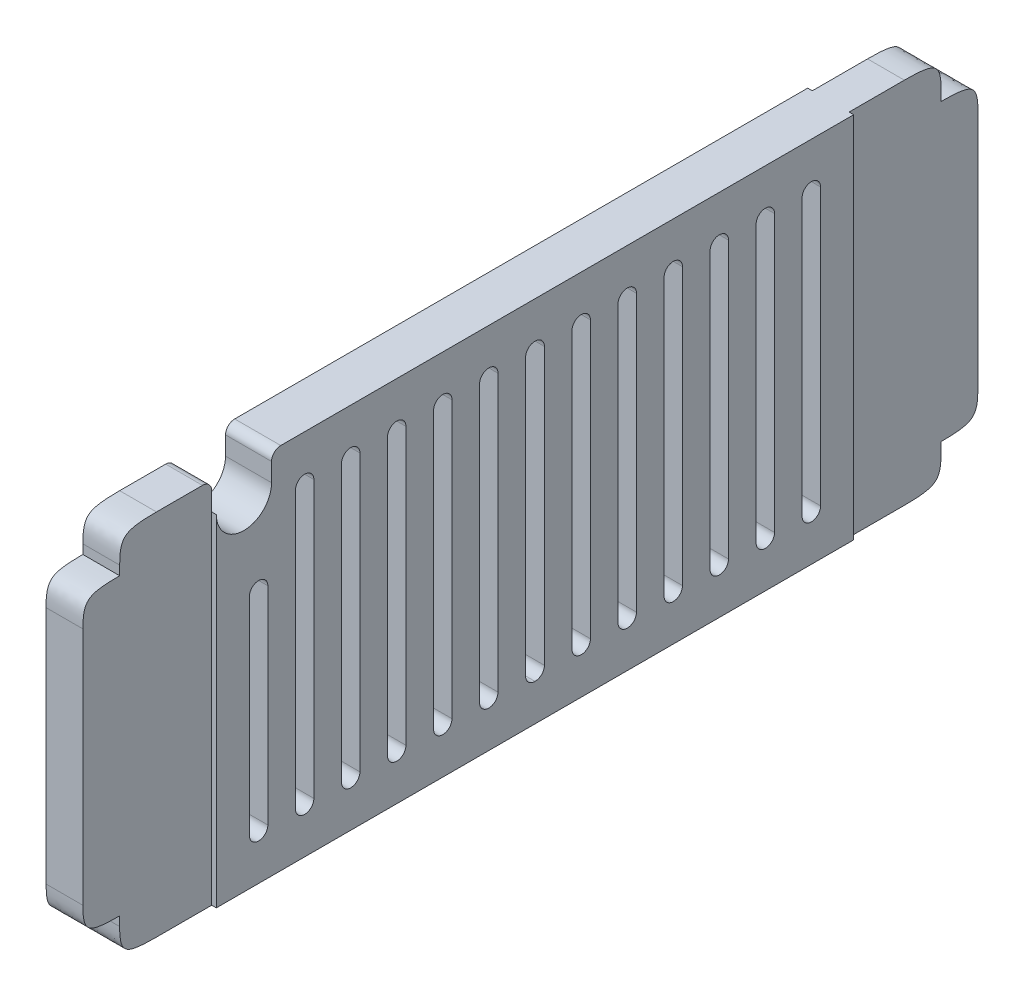
from build123d import *

# Parameters (mm, degrees)
BOSS_EXTRUDE1_DEPTH     = 25.4
SKETCH2_W               = 2.54
SKETCH2_H               = 20.32
BOSS_EXTRUDE2_DEPTH     = 2.54
CUT_EXTRUDE1_DEPTH      = 71.353988153
CUT_EXTRUDE1_DEPTH_BACK = 71.353988153
FILLET1_SIZE            = 2.54
FILLET1_SIZE_2          = 1.905
FILLET2_SIZE            = 2.54
FILLET2_SIZE_2          = 1.905
CUT_EXTRUDE2_DEPTH      = 71.353988282
CUT_EXTRUDE2_DEPTH_BACK = 71.353988282
SKETCH4_W               = 43.097939212
SKETCH4_H               = 25.4
BOSS_EXTRUDE3_START     = -3.175
BOSS_EXTRUDE3_DEPTH     = 3.175
BOSS_EXTRUDE4_DEPTH     = 2.54
CUT_EXTRUDE3_DEPTH      = 59.690250859
BOSS_EXTRUDE5_START     = -3.175
SKETCH10_W              = 50.316222456
SKETCH10_H              = 25.4
BOSS_EXTRUDE5_DEPTH     = 3.175
CUT_EXTRUDE4_DEPTH      = 63.179589879
BOSS_EXTRUDE6_DEPTH     = 2.54
CUT_EXTRUDE5_DEPTH      = 71.362942144
BOSS_EXTRUDE7_DEPTH     = 3.175
BOSS_EXTRUDE8_DEPTH     = 2.54
CUT_EXTRUDE6_DEPTH      = 71.376551108
BOSS_EXTRUDE9_DEPTH     = 3.175
FILLET3_R               = 0.635


with BuildPart() as part:
    # Sketch1 → Boss-Extrude1 (new body)
    with BuildSketch(Plane(origin=(0, 0, 0), x_dir=(1, 0, 0), z_dir=(0, 1, 0))):
        Polygon((0, -6.35), (0, 0), (2.54, 0), (2.54, -6.35), (2.8575, -6.35), (2.8575, -56.642), (2.54, -56.642), (2.54, -62.992), (0, -62.992), (0, -56.642), (-0.3175, -56.642), (-0.3175, -6.35), align=None)
    extrude(amount=BOSS_EXTRUDE1_DEPTH)

    # Sketch2 → Boss-Extrude2 (add)
    with BuildSketch(Plane(origin=(2.54, 0, 0), x_dir=(0, 0, -1), z_dir=(1, 0, 0))):
        with Locations((-64.262, 12.7)):
            Rectangle(SKETCH2_W, SKETCH2_H)
        with Locations((1.27, 12.7)):
            Rectangle(SKETCH2_W, SKETCH2_H)
    extrude(amount=-BOSS_EXTRUDE2_DEPTH)

    # Sketch3 → Cut-Extrude1 (cut, two sides: drawn at the far end of the back side and taken through both)
    with BuildSketch(Plane.ZY.offset(0.3175).offset(-CUT_EXTRUDE1_DEPTH_BACK)):
        with BuildLine():
            Line((30.861, 3.175), (30.861, 22.225))
            ThreePointArc((30.861, 22.225), (31.496, 22.86), (32.131, 22.225))
            Line((32.131, 22.225), (32.131, 3.175))
            ThreePointArc((32.131, 3.175), (31.496, 2.54), (30.861, 3.175))
        make_face()
        with BuildLine():
            Line((35.306, 3.175), (35.306, 22.225))
            ThreePointArc((35.306, 22.225), (34.671, 22.86), (34.036, 22.225))
            Line((34.036, 22.225), (34.036, 3.175))
            ThreePointArc((34.036, 3.175), (34.671, 2.54), (35.306, 3.175))
        make_face()
        with BuildLine():
            Line((38.481, 3.175), (38.481, 22.225))
            ThreePointArc((38.481, 22.225), (37.846, 22.86), (37.211, 22.225))
            Line((37.211, 22.225), (37.211, 3.175))
            ThreePointArc((37.211, 3.175), (37.846, 2.54), (38.481, 3.175))
        make_face()
        with BuildLine():
            Line((41.656, 3.175), (41.656, 22.225))
            ThreePointArc((41.656, 22.225), (41.021, 22.86), (40.386, 22.225))
            Line((40.386, 22.225), (40.386, 3.175))
            ThreePointArc((40.386, 3.175), (41.021, 2.54), (41.656, 3.175))
        make_face()
        with BuildLine():
            Line((44.831, 3.175), (44.831, 22.225))
            ThreePointArc((44.831, 22.225), (44.196, 22.86), (43.561, 22.225))
            Line((43.561, 22.225), (43.561, 3.175))
            ThreePointArc((43.561, 3.175), (44.196, 2.54), (44.831, 3.175))
        make_face()
        with BuildLine():
            Line((48.006, 3.175), (48.006, 22.225))
            ThreePointArc((48.006, 22.225), (47.371, 22.86), (46.736, 22.225))
            Line((46.736, 22.225), (46.736, 3.175))
            ThreePointArc((46.736, 3.175), (47.371, 2.54), (48.006, 3.175))
        make_face()
        with BuildLine():
            Line((51.181, 3.175), (51.181, 22.225))
            ThreePointArc((51.181, 22.225), (50.546, 22.86), (49.911, 22.225))
            Line((49.911, 22.225), (49.911, 3.175))
            ThreePointArc((49.911, 3.175), (50.546, 2.54), (51.181, 3.175))
        make_face()
        with BuildLine():
            Line((54.356, 3.175), (54.356, 22.225))
            ThreePointArc((54.356, 22.225), (53.721, 22.86), (53.086, 22.225))
            Line((53.086, 22.225), (53.086, 3.175))
            ThreePointArc((53.086, 3.175), (53.721, 2.54), (54.356, 3.175))
        make_face()
        with BuildLine():
            Line((27.686, 3.175), (27.686, 22.225))
            ThreePointArc((27.686, 22.225), (28.321, 22.86), (28.956, 22.225))
            Line((28.956, 22.225), (28.956, 3.175))
            ThreePointArc((28.956, 3.175), (28.321, 2.54), (27.686, 3.175))
        make_face()
        with BuildLine():
            Line((24.511, 3.175), (24.511, 22.225))
            ThreePointArc((24.511, 22.225), (25.146, 22.86), (25.781, 22.225))
            Line((25.781, 22.225), (25.781, 3.175))
            ThreePointArc((25.781, 3.175), (25.146, 2.54), (24.511, 3.175))
        make_face()
        with BuildLine():
            Line((21.336, 3.175), (21.336, 22.225))
            ThreePointArc((21.336, 22.225), (21.971, 22.86), (22.606, 22.225))
            Line((22.606, 22.225), (22.606, 3.175))
            ThreePointArc((22.606, 3.175), (21.971, 2.54), (21.336, 3.175))
        make_face()
        with BuildLine():
            Line((18.161, 3.175), (18.161, 22.225))
            ThreePointArc((18.161, 22.225), (18.796, 22.86), (19.431, 22.225))
            Line((19.431, 22.225), (19.431, 3.175))
            ThreePointArc((19.431, 3.175), (18.796, 2.54), (18.161, 3.175))
        make_face()
        with BuildLine():
            Line((14.986, 3.175), (14.986, 22.225))
            ThreePointArc((14.986, 22.225), (15.621, 22.86), (16.256, 22.225))
            Line((16.256, 22.225), (16.256, 3.175))
            ThreePointArc((16.256, 3.175), (15.621, 2.54), (14.986, 3.175))
        make_face()
        with BuildLine():
            Line((11.811, 3.175), (11.811, 22.225))
            ThreePointArc((11.811, 22.225), (12.446, 22.86), (13.081, 22.225))
            Line((13.081, 22.225), (13.081, 3.175))
            ThreePointArc((13.081, 3.175), (12.446, 2.54), (11.811, 3.175))
        make_face()
        with BuildLine():
            Line((8.636, 3.175), (8.636, 22.225))
            ThreePointArc((8.636, 22.225), (9.271, 22.86), (9.906, 22.225))
            Line((9.906, 22.225), (9.906, 3.175))
            ThreePointArc((9.906, 3.175), (9.271, 2.54), (8.636, 3.175))
        make_face()
    extrude(amount=CUT_EXTRUDE1_DEPTH + CUT_EXTRUDE1_DEPTH_BACK, mode=Mode.SUBTRACT)

    # Fillet1
    # a fillet whose section is not a circle: 2.54, 1.905 mm, written as the material it takes off along each edge
    with BuildSketch(Plane(origin=(8.89, 22.86, 65.532), x_dir=(0, 0, -1), z_dir=(-1, 0, 0)), Plane(origin=(8.89, 25.4, 62.992), x_dir=(0, 0, -1), z_dir=(-1, 0, 0))) as fillet1_piece_1:
        with BuildLine():
            Bezier((FILLET1_SIZE, 0), (0, 0), (0, FILLET1_SIZE_2), weights=[1, 1.857142857, 1])
            Line((0, FILLET1_SIZE_2), (0, 0))
            Line((0, 0), (FILLET1_SIZE, 0))
        make_face()
    extrude(amount=15.24, mode=Mode.SUBTRACT)
    with BuildSketch(Plane(origin=(8.89, 2.54, -2.54), x_dir=(0, 1, 0), z_dir=(-1, 0, 0))) as fillet1_piece_2:
        with BuildLine():
            Bezier((FILLET1_SIZE_2, 0), (0, 0), (0, -FILLET1_SIZE), weights=[1, 1.857142857, 1])
            Line((0, -FILLET1_SIZE), (0, 0))
            Line((0, 0), (FILLET1_SIZE_2, 0))
        make_face()
    extrude(amount=15.24, mode=Mode.SUBTRACT)
    with BuildSketch(Plane(origin=(-6.35, 0, 0), x_dir=(0, 1, 0), z_dir=(1, 0, 0))) as fillet1_piece_3:
        with BuildLine():
            Bezier((FILLET1_SIZE_2, 0), (0, 0), (0, FILLET1_SIZE), weights=[1, 1.857142857, 1])
            Line((0, FILLET1_SIZE), (0, 0))
            Line((0, 0), (FILLET1_SIZE_2, 0))
        make_face()
    extrude(amount=15.24, mode=Mode.SUBTRACT)

    # Fillet2
    # a fillet whose section is not a circle: 2.54, 1.905 mm, written as the material it takes off along each edge
    with BuildSketch(Plane(origin=(8.89, 0, 62.992), x_dir=(0, 0, -1), z_dir=(-1, 0, 0))) as fillet2_piece_1:
        with BuildLine():
            Bezier((FILLET2_SIZE, 0), (0, 0), (0, -FILLET2_SIZE_2), weights=[1, 1.857142857, 1])
            Line((0, -FILLET2_SIZE_2), (0, 0))
            Line((0, 0), (FILLET2_SIZE, 0))
        make_face()
    extrude(amount=15.24, mode=Mode.SUBTRACT)
    with BuildSketch(Plane(origin=(8.89, 2.54, 65.532), x_dir=(0, 1, 0), z_dir=(-1, 0, 0)), Plane(origin=(8.89, 22.86, -2.54), x_dir=(0, -1, 0), z_dir=(-1, 0, 0))) as fillet2_piece_2:
        with BuildLine():
            Bezier((FILLET2_SIZE_2, 0), (0, 0), (0, FILLET2_SIZE), weights=[1, 1.857142857, 1])
            Line((0, FILLET2_SIZE), (0, 0))
            Line((0, 0), (FILLET2_SIZE_2, 0))
        make_face()
    extrude(amount=15.24, mode=Mode.SUBTRACT)
    with BuildSketch(Plane(origin=(-6.35, 25.4, 0), x_dir=(0, -1, 0), z_dir=(1, 0, 0))) as fillet2_piece_3:
        with BuildLine():
            Bezier((FILLET2_SIZE_2, 0), (0, 0), (0, -FILLET2_SIZE), weights=[1, 1.857142857, 1])
            Line((0, -FILLET2_SIZE), (0, 0))
            Line((0, 0), (FILLET2_SIZE_2, 0))
        make_face()
    extrude(amount=15.24, mode=Mode.SUBTRACT)

    # Sketch4 → Cut-Extrude2 (cut, two sides: drawn at the far end of the back side and taken through both)
    with BuildSketch(Plane.ZY.offset(0.3175).offset(-CUT_EXTRUDE2_DEPTH_BACK)):
        with Locations((46.694969606, 12.7)):
            Rectangle(SKETCH4_W, SKETCH4_H)
    extrude(amount=CUT_EXTRUDE2_DEPTH + CUT_EXTRUDE2_DEPTH_BACK, mode=Mode.SUBTRACT)

    # Sketch5 → Boss-Extrude3 (add)
    with BuildSketch(Plane.ZY.offset(0.3175).offset(BOSS_EXTRUDE3_START)):
        with BuildLine():
            Line((25.146, 2.54), (25.146, 0))
            Line((25.146, 0), (43.942, 0))
            Line((43.942, 0), (43.942, 25.4))
            Line((43.942, 25.4), (25.146, 25.4))
            Line((25.146, 25.4), (25.146, 22.86))
            ThreePointArc((25.146, 22.86), (25.595012806, 22.674012806), (25.781, 22.225))
            Line((25.781, 22.225), (25.781, 3.175))
            ThreePointArc((25.781, 3.175), (25.595012806, 2.725987194), (25.146, 2.54))
        make_face()
        with BuildLine():
            ThreePointArc((28.956, 3.175), (28.321, 2.54), (27.686, 3.175))
            Line((27.686, 3.175), (27.686, 22.225))
            ThreePointArc((27.686, 22.225), (28.321, 22.86), (28.956, 22.225))
            Line((28.956, 22.225), (28.956, 3.175))
        make_face(mode=Mode.SUBTRACT)
        with BuildLine():
            ThreePointArc((32.131, 3.175), (31.496, 2.54), (30.861, 3.175))
            Line((30.861, 3.175), (30.861, 22.225))
            ThreePointArc((30.861, 22.225), (31.496, 22.86), (32.131, 22.225))
            Line((32.131, 22.225), (32.131, 3.175))
        make_face(mode=Mode.SUBTRACT)
        with BuildLine():
            ThreePointArc((35.306, 3.175), (34.671, 2.54), (34.036, 3.175))
            Line((34.036, 3.175), (34.036, 22.225))
            ThreePointArc((34.036, 22.225), (34.671, 22.86), (35.306, 22.225))
            Line((35.306, 22.225), (35.306, 3.175))
        make_face(mode=Mode.SUBTRACT)
        with BuildLine():
            ThreePointArc((38.481, 3.175), (37.846, 2.54), (37.211, 3.175))
            Line((37.211, 3.175), (37.211, 22.225))
            ThreePointArc((37.211, 22.225), (37.846, 22.86), (38.481, 22.225))
            Line((38.481, 22.225), (38.481, 3.175))
        make_face(mode=Mode.SUBTRACT)
        with BuildLine():
            ThreePointArc((41.656, 3.175), (41.021, 2.54), (40.386, 3.175))
            Line((40.386, 3.175), (40.386, 22.225))
            ThreePointArc((40.386, 22.225), (41.021, 22.86), (41.656, 22.225))
            Line((41.656, 22.225), (41.656, 3.175))
        make_face(mode=Mode.SUBTRACT)
    extrude(amount=BOSS_EXTRUDE3_DEPTH)

    # Sketch7 → Boss-Extrude4 (add)
    with BuildSketch(Plane(origin=(2.54, 0, 0), x_dir=(0, 0, -1), z_dir=(1, 0, 0))):
        with BuildLine():
            Line((-52.832, 4.445), (-52.832, 20.955))
            add(Edge.make_bspline(
                [(-52.832, 20.955), (-52.832, 21.566264843), (-52.750077784, 21.912584205), (-52.686519964, 22.181269612), (-52.560992149, 22.351895719), (-52.424583279, 22.537312112), (-52.184197152, 22.64402579), (-51.86738437, 22.784667255), (-51.247913024, 22.831116446), (-50.862706444, 22.86), (-50.292, 22.86)],
                knots=[0, 0, 0, 0.25, 0.25, 0.375, 0.375, 0.5, 0.5, 0.75, 0.75, 1, 1, 1], degree=2))
            Line((-50.292, 22.86), (-50.292, 23.495))
            add(Edge.make_bspline(
                [(-50.292, 23.495), (-50.292, 24.106264843), (-50.210077784, 24.452584205), (-50.146519964, 24.721269612), (-50.020992149, 24.891895719), (-49.884583279, 25.077312112), (-49.644197152, 25.18402579), (-49.32738437, 25.324667255), (-48.707913024, 25.371116446), (-48.322706444, 25.4), (-47.752, 25.4)],
                knots=[0, 0, 0, 0.25, 0.25, 0.375, 0.375, 0.5, 0.5, 0.75, 0.75, 1, 1, 1], degree=2))
            Line((-47.752, 25.4), (-43.942, 25.4))
            Line((-43.942, 25.4), (-43.942, 0))
            Line((-43.942, 0), (-47.752, 0))
            add(Edge.make_bspline(
                [(-47.752, 0), (-48.318489299, 0), (-48.702995081, 0.028516811), (-48.970475744, 0.048354472), (-49.174540832, 0.083620934), (-49.44980427, 0.13119187), (-49.637333595, 0.212954611), (-49.87968847, 0.318621278), (-50.018240947, 0.504390158), (-50.145388249, 0.674867167), (-50.209974667, 0.946980609), (-50.292, 1.29256713), (-50.292, 1.905)],
                knots=[0, 0, 0, 0.25, 0.25, 0.375, 0.375, 0.5, 0.5, 0.625, 0.625, 0.75, 0.75, 1, 1, 1], degree=2))
            Line((-50.292, 1.905), (-50.292, 2.54))
            add(Edge.make_bspline(
                [(-50.292, 2.54), (-50.858489299, 2.54), (-51.242995081, 2.568516811), (-51.510475744, 2.588354472), (-51.714540832, 2.623620934), (-51.98980427, 2.67119187), (-52.177333595, 2.752954611), (-52.41968847, 2.858621278), (-52.558240947, 3.044390158), (-52.685388249, 3.214867167), (-52.749974667, 3.486980609), (-52.832, 3.83256713), (-52.832, 4.445)],
                knots=[0, 0, 0, 0.25, 0.25, 0.375, 0.375, 0.5, 0.5, 0.625, 0.625, 0.75, 0.75, 1, 1, 1], degree=2))
        make_face()
        with BuildLine():
            Line((0, 22.86), (0, 23.495))
            add(Edge.make_bspline(
                [(0, 23.495), (0, 24.106264843), (-0.081922216, 24.452584205), (-0.145480036, 24.721269612), (-0.271007851, 24.891895719), (-0.407416721, 25.077312112), (-0.647802848, 25.18402579), (-0.96461563, 25.324667255), (-1.584086976, 25.371116446), (-1.969293556, 25.4), (-2.54, 25.4)],
                knots=[0, 0, 0, 0.25, 0.25, 0.375, 0.375, 0.5, 0.5, 0.75, 0.75, 1, 1, 1], degree=2))
            Line((-2.54, 25.4), (-6.35, 25.4))
            Line((-6.35, 25.4), (-6.35, 0))
            Line((-6.35, 0), (-2.54, 0))
            add(Edge.make_bspline(
                [(-2.54, 0), (-1.973510701, 0), (-1.589004919, 0.028516811), (-1.321524256, 0.048354472), (-1.117459168, 0.083620934), (-0.84219573, 0.13119187), (-0.654666405, 0.212954611), (-0.41231153, 0.318621278), (-0.273759053, 0.504390158), (-0.146611751, 0.674867167), (-0.082025333, 0.946980609), (0, 1.29256713), (0, 1.905)],
                knots=[0, 0, 0, 0.25, 0.25, 0.375, 0.375, 0.5, 0.5, 0.625, 0.625, 0.75, 0.75, 1, 1, 1], degree=2))
            Line((0, 1.905), (0, 2.54))
            add(Edge.make_bspline(
                [(0, 2.54), (0.566489299, 2.54), (0.950995081, 2.568516811), (1.218475744, 2.588354472), (1.422540832, 2.623620934), (1.69780427, 2.67119187), (1.885333595, 2.752954611), (2.12768847, 2.858621278), (2.266240947, 3.044390158), (2.393388249, 3.214867167), (2.457974667, 3.486980609), (2.54, 3.83256713), (2.54, 4.445)],
                knots=[0, 0, 0, 0.25, 0.25, 0.375, 0.375, 0.5, 0.5, 0.625, 0.625, 0.75, 0.75, 1, 1, 1], degree=2))
            Line((2.54, 4.445), (2.54, 20.955))
            add(Edge.make_bspline(
                [(2.54, 20.955), (2.54, 21.566264843), (2.458077784, 21.912584205), (2.394519964, 22.181269612), (2.268992149, 22.351895719), (2.132583279, 22.537312112), (1.892197152, 22.64402579), (1.57538437, 22.784667255), (0.955913024, 22.831116446), (0.570706444, 22.86), (0, 22.86)],
                knots=[0, 0, 0, 0.25, 0.25, 0.375, 0.375, 0.5, 0.5, 0.75, 0.75, 1, 1, 1], degree=2))
        make_face()
    extrude(amount=-BOSS_EXTRUDE4_DEPTH)

    # Sketch9 → Cut-Extrude3 (cut, through all)
    with BuildSketch(Plane(origin=(0, 25.4, 0), x_dir=(1, 0, 0), z_dir=(0, 1, 0))):
        Polygon((2.54, -31.508111228), (13.884104401, -31.508111228), (13.884104401, -57.156449868), (-12.424079093, -57.156449868), (-12.424079093, -31.508111228), align=None)
    extrude(amount=-CUT_EXTRUDE3_DEPTH, mode=Mode.SUBTRACT)

    # Sketch10 → Boss-Extrude5 (add)
    with BuildSketch(Plane.ZY.offset(0.3175).offset(BOSS_EXTRUDE5_START)):
        with Locations((31.508111228, 12.7)):
            Rectangle(SKETCH10_W, SKETCH10_H)
        with BuildLine():
            Line((27.686, 3.175), (27.686, 22.225))
            ThreePointArc((27.686, 22.225), (28.321, 22.86), (28.956, 22.225))
            Line((28.956, 22.225), (28.956, 3.175))
            ThreePointArc((28.956, 3.175), (28.321, 2.54), (27.686, 3.175))
        make_face(mode=Mode.SUBTRACT)
        with BuildLine():
            Line((24.511, 3.175), (24.511, 22.225))
            ThreePointArc((24.511, 22.225), (25.146, 22.86), (25.781, 22.225))
            Line((25.781, 22.225), (25.781, 3.175))
            ThreePointArc((25.781, 3.175), (25.146, 2.54), (24.511, 3.175))
        make_face(mode=Mode.SUBTRACT)
        with BuildLine():
            Line((21.336, 3.175), (21.336, 22.225))
            ThreePointArc((21.336, 22.225), (21.971, 22.86), (22.606, 22.225))
            Line((22.606, 22.225), (22.606, 3.175))
            ThreePointArc((22.606, 3.175), (21.971, 2.54), (21.336, 3.175))
        make_face(mode=Mode.SUBTRACT)
        with BuildLine():
            Line((18.161, 3.175), (18.161, 22.225))
            ThreePointArc((18.161, 22.225), (18.796, 22.86), (19.431, 22.225))
            Line((19.431, 22.225), (19.431, 3.175))
            ThreePointArc((19.431, 3.175), (18.796, 2.54), (18.161, 3.175))
        make_face(mode=Mode.SUBTRACT)
        with BuildLine():
            Line((14.986, 3.175), (14.986, 22.225))
            ThreePointArc((14.986, 22.225), (15.621, 22.86), (16.256, 22.225))
            Line((16.256, 22.225), (16.256, 3.175))
            ThreePointArc((16.256, 3.175), (15.621, 2.54), (14.986, 3.175))
        make_face(mode=Mode.SUBTRACT)
        with BuildLine():
            Line((11.811, 3.175), (11.811, 22.225))
            ThreePointArc((11.811, 22.225), (12.446, 22.86), (13.081, 22.225))
            Line((13.081, 22.225), (13.081, 3.175))
            ThreePointArc((13.081, 3.175), (12.446, 2.54), (11.811, 3.175))
        make_face(mode=Mode.SUBTRACT)
        with BuildLine():
            Line((8.636, 3.175), (8.636, 22.225))
            ThreePointArc((8.636, 22.225), (9.271, 22.86), (9.906, 22.225))
            Line((9.906, 22.225), (9.906, 3.175))
            ThreePointArc((9.906, 3.175), (9.271, 2.54), (8.636, 3.175))
        make_face(mode=Mode.SUBTRACT)
        with BuildLine():
            Line((53.110222456, 22.225), (53.110222456, 3.175))
            ThreePointArc((53.110222456, 3.175), (53.745222456, 2.54), (54.380222456, 3.175))
            Line((54.380222456, 3.175), (54.380222456, 22.225))
            ThreePointArc((54.380222456, 22.225), (53.745222456, 22.86), (53.110222456, 22.225))
        make_face(mode=Mode.SUBTRACT)
        with BuildLine():
            Line((49.935222456, 22.225), (49.935222456, 3.175))
            ThreePointArc((49.935222456, 3.175), (50.570222456, 2.54), (51.205222456, 3.175))
            Line((51.205222456, 3.175), (51.205222456, 22.225))
            ThreePointArc((51.205222456, 22.225), (50.570222456, 22.86), (49.935222456, 22.225))
        make_face(mode=Mode.SUBTRACT)
        with BuildLine():
            Line((46.760222456, 22.225), (46.760222456, 3.175))
            ThreePointArc((46.760222456, 3.175), (47.395222456, 2.54), (48.030222456, 3.175))
            Line((48.030222456, 3.175), (48.030222456, 22.225))
            ThreePointArc((48.030222456, 22.225), (47.395222456, 22.86), (46.760222456, 22.225))
        make_face(mode=Mode.SUBTRACT)
        with BuildLine():
            Line((43.585222456, 22.225), (43.585222456, 3.175))
            ThreePointArc((43.585222456, 3.175), (44.220222456, 2.54), (44.855222456, 3.175))
            Line((44.855222456, 3.175), (44.855222456, 22.225))
            ThreePointArc((44.855222456, 22.225), (44.220222456, 22.86), (43.585222456, 22.225))
        make_face(mode=Mode.SUBTRACT)
        with BuildLine():
            Line((40.410222456, 22.225), (40.410222456, 3.175))
            ThreePointArc((40.410222456, 3.175), (41.045222456, 2.54), (41.680222456, 3.175))
            Line((41.680222456, 3.175), (41.680222456, 22.225))
            ThreePointArc((41.680222456, 22.225), (41.045222456, 22.86), (40.410222456, 22.225))
        make_face(mode=Mode.SUBTRACT)
        with BuildLine():
            Line((37.235222456, 22.225), (37.235222456, 3.175))
            ThreePointArc((37.235222456, 3.175), (37.870222456, 2.54), (38.505222456, 3.175))
            Line((38.505222456, 3.175), (38.505222456, 22.225))
            ThreePointArc((38.505222456, 22.225), (37.870222456, 22.86), (37.235222456, 22.225))
        make_face(mode=Mode.SUBTRACT)
        with BuildLine():
            Line((34.060222456, 22.225), (34.060222456, 3.175))
            ThreePointArc((34.060222456, 3.175), (34.695222456, 2.54), (35.330222456, 3.175))
            Line((35.330222456, 3.175), (35.330222456, 22.225))
            ThreePointArc((35.330222456, 22.225), (34.695222456, 22.86), (34.060222456, 22.225))
        make_face(mode=Mode.SUBTRACT)
    extrude(amount=BOSS_EXTRUDE5_DEPTH)

    # Sketch11 → Cut-Extrude4 (cut, through all)
    with BuildSketch(Plane.ZY.offset(0.3175)):
        with BuildLine():
            Line((27.686, 3.175), (27.686, 22.225))
            ThreePointArc((27.686, 22.225), (28.321, 22.86), (28.956, 22.225))
            Line((28.956, 22.225), (28.956, 3.175))
            ThreePointArc((28.956, 3.175), (28.321, 2.54), (27.686, 3.175))
        make_face()
        with BuildLine():
            Line((32.131, 22.225), (32.131, 3.175))
            ThreePointArc((32.131, 3.175), (31.496, 2.54), (30.861, 3.175))
            Line((30.861, 3.175), (30.861, 22.225))
            ThreePointArc((30.861, 22.225), (31.496, 22.86), (32.131, 22.225))
        make_face()
    extrude(amount=-CUT_EXTRUDE4_DEPTH, mode=Mode.SUBTRACT)

    # Sketch12 → Boss-Extrude6 (add)
    with BuildSketch(Plane.ZY):
        with BuildLine():
            Line((56.666222456, 0), (56.666222456, 25.4))
            Line((56.666222456, 25.4), (60.476222456, 25.4))
            add(Edge.make_bspline(
                [(60.476222456, 25.4), (61.042706071, 25.4), (61.427217537, 25.371483189), (62.043328615, 25.325790083), (62.361556051, 25.187045389), (62.603904826, 25.081383202), (62.742463403, 24.895609842), (62.869607737, 24.725140205), (62.934197123, 24.453019391), (63.016222456, 24.107439388), (63.016222456, 23.495)],
                knots=[0, 0, 0, 0.25, 0.25, 0.5, 0.5, 0.625, 0.625, 0.75, 0.75, 1, 1, 1], degree=2))
            Line((63.016222456, 23.495), (63.016222456, 22.86))
            add(Edge.make_bspline(
                [(63.016222456, 22.86), (63.582706071, 22.86), (63.967217537, 22.831483189), (64.583328615, 22.785790083), (64.901556051, 22.647045389), (65.143904826, 22.541383202), (65.282463403, 22.355609842), (65.409607737, 22.185140205), (65.474197123, 21.913019391), (65.556222456, 21.567439388), (65.556222456, 20.955)],
                knots=[0, 0, 0, 0.25, 0.25, 0.5, 0.5, 0.625, 0.625, 0.75, 0.75, 1, 1, 1], degree=2))
            Line((65.556222456, 20.955), (65.556222456, 4.445))
            add(Edge.make_bspline(
                [(65.556222456, 4.445), (65.556222456, 3.833768563), (65.47430024, 3.487415795), (65.410750299, 3.218737782), (65.285214605, 3.048104281), (65.148812167, 2.862700233), (64.908419608, 2.75597421), (64.72271898, 2.673529523), (64.447164672, 2.625085298), (64.243032164, 2.589197487), (63.97213548, 2.568883554), (63.586958517, 2.54), (63.016222456, 2.54)],
                knots=[0, 0, 0, 0.25, 0.25, 0.375, 0.375, 0.5, 0.5, 0.625, 0.625, 0.75, 0.75, 1, 1, 1], degree=2))
            Line((63.016222456, 2.54), (63.016222456, 1.905))
            add(Edge.make_bspline(
                [(63.016222456, 1.905), (63.016222456, 1.293768563), (62.93430024, 0.947415795), (62.870750299, 0.678737782), (62.745214605, 0.508104281), (62.608812167, 0.322700233), (62.368419608, 0.21597421), (62.18271898, 0.133529523), (61.907164672, 0.085085298), (61.703032164, 0.049197487), (61.43213548, 0.028883554), (61.046958516, 0), (60.476222456, 0)],
                knots=[0, 0, 0, 0.25, 0.25, 0.375, 0.375, 0.5, 0.5, 0.625, 0.625, 0.75, 0.75, 1, 1, 1], degree=2))
            Line((60.476222456, 0), (56.666222456, 0))
        make_face()
        with BuildLine():
            Line((6.35, 25.4), (2.54, 25.4))
            add(Edge.make_bspline(
                [(2.54, 25.4), (1.973516385, 25.4), (1.589004919, 25.371483189), (0.972893841, 25.325790083), (0.654666405, 25.187045389), (0.41231763, 25.081383202), (0.273759053, 24.895609842), (0.146614719, 24.725140205), (0.082025333, 24.453019391), (0, 24.107439388), (0, 23.495)],
                knots=[0, 0, 0, 0.25, 0.25, 0.5, 0.5, 0.625, 0.625, 0.75, 0.75, 1, 1, 1], degree=2))
            Line((0, 23.495), (0, 22.86))
            add(Edge.make_bspline(
                [(0, 22.86), (-0.566483615, 22.86), (-0.950995081, 22.831483189), (-1.567106159, 22.785790083), (-1.885333595, 22.647045389), (-2.12768237, 22.541383202), (-2.266240947, 22.355609842), (-2.393385281, 22.185140205), (-2.457974667, 21.913019391), (-2.54, 21.567439388), (-2.54, 20.955)],
                knots=[0, 0, 0, 0.25, 0.25, 0.5, 0.5, 0.625, 0.625, 0.75, 0.75, 1, 1, 1], degree=2))
            Line((-2.54, 20.955), (-2.54, 4.445))
            add(Edge.make_bspline(
                [(-2.54, 4.445), (-2.54, 3.833768563), (-2.458077784, 3.487415795), (-2.394527843, 3.218737782), (-2.268992149, 3.048104281), (-2.132589711, 2.862700233), (-1.892197152, 2.75597421), (-1.706496524, 2.673529523), (-1.430942216, 2.625085298), (-1.226809708, 2.589197487), (-0.955913024, 2.568883554), (-0.570736061, 2.54), (0, 2.54)],
                knots=[0, 0, 0, 0.25, 0.25, 0.375, 0.375, 0.5, 0.5, 0.625, 0.625, 0.75, 0.75, 1, 1, 1], degree=2))
            Line((0, 2.54), (0, 1.905))
            add(Edge.make_bspline(
                [(0, 1.905), (0, 1.293768563), (0.081922216, 0.947415795), (0.145472157, 0.678737782), (0.271007851, 0.508104281), (0.407410289, 0.322700233), (0.647802848, 0.21597421), (0.833503476, 0.133529523), (1.109057784, 0.085085298), (1.313190292, 0.049197487), (1.584086976, 0.028883554), (1.96926394, 0), (2.54, 0)],
                knots=[0, 0, 0, 0.25, 0.25, 0.375, 0.375, 0.5, 0.5, 0.625, 0.625, 0.75, 0.75, 1, 1, 1], degree=2))
            Line((2.54, 0), (6.35, 0))
            Line((6.35, 0), (6.35, 25.4))
        make_face()
    extrude(amount=-BOSS_EXTRUDE6_DEPTH)

    # Sketch14 → Cut-Extrude5 (cut, through all)
    with BuildSketch(Plane(origin=(0, 25.4, 0), x_dir=(1, 0, 0), z_dir=(0, 1, 0))):
        Polygon((-0.3175, -34.682375136), (17.206407461, -34.682375136), (17.206407461, 7.164237544), (-50.816625814, 7.164237544), align=None)
    extrude(amount=-CUT_EXTRUDE5_DEPTH, mode=Mode.SUBTRACT)

    # Sketch15 → Boss-Extrude7 (add)
    with BuildSketch(Plane.ZY.offset(0.3175)):
        with BuildLine():
            Line((34.682375136, 22.859870023), (34.682375136, 25.4))
            Line((34.682375136, 25.4), (12.698527816, 25.4))
            Line((12.698527816, 25.4), (12.698527816, 0))
            Line((12.698527816, 0), (34.682375136, 0))
            Line((34.682375136, 0), (34.682375136, 2.540129977))
            ThreePointArc((34.682375136, 2.540129977), (34.225080433, 2.721467725), (34.034527816, 3.175))
            Line((34.034527816, 3.175), (34.034527816, 22.225))
            ThreePointArc((34.034527816, 22.225), (34.225080433, 22.678532275), (34.682375136, 22.859870023))
        make_face()
        with BuildLine():
            ThreePointArc((16.254527816, 3.175), (15.619527816, 2.54), (14.984527816, 3.175))
            Line((14.984527816, 3.175), (14.984527816, 22.225))
            ThreePointArc((14.984527816, 22.225), (15.619527816, 22.86), (16.254527816, 22.225))
            Line((16.254527816, 22.225), (16.254527816, 3.175))
        make_face(mode=Mode.SUBTRACT)
        with BuildLine():
            ThreePointArc((19.429527816, 3.175), (18.794527816, 2.54), (18.159527816, 3.175))
            Line((18.159527816, 3.175), (18.159527816, 22.225))
            ThreePointArc((18.159527816, 22.225), (18.794527816, 22.86), (19.429527816, 22.225))
            Line((19.429527816, 22.225), (19.429527816, 3.175))
        make_face(mode=Mode.SUBTRACT)
        with BuildLine():
            ThreePointArc((22.604527816, 3.175), (21.969527816, 2.54), (21.334527816, 3.175))
            Line((21.334527816, 3.175), (21.334527816, 22.225))
            ThreePointArc((21.334527816, 22.225), (21.969527816, 22.86), (22.604527816, 22.225))
            Line((22.604527816, 22.225), (22.604527816, 3.175))
        make_face(mode=Mode.SUBTRACT)
        with BuildLine():
            ThreePointArc((25.779527816, 3.175), (25.144527816, 2.54), (24.509527816, 3.175))
            Line((24.509527816, 3.175), (24.509527816, 22.225))
            ThreePointArc((24.509527816, 22.225), (25.144527816, 22.86), (25.779527816, 22.225))
            Line((25.779527816, 22.225), (25.779527816, 3.175))
        make_face(mode=Mode.SUBTRACT)
        with BuildLine():
            ThreePointArc((28.954527816, 3.175), (28.319527816, 2.54), (27.684527816, 3.175))
            Line((27.684527816, 3.175), (27.684527816, 22.225))
            ThreePointArc((27.684527816, 22.225), (28.319527816, 22.86), (28.954527816, 22.225))
            Line((28.954527816, 22.225), (28.954527816, 3.175))
        make_face(mode=Mode.SUBTRACT)
        with BuildLine():
            ThreePointArc((30.859527816, 22.225), (31.494527816, 22.86), (32.129527816, 22.225))
            Line((32.129527816, 22.225), (32.129527816, 3.175))
            ThreePointArc((32.129527816, 3.175), (31.494527816, 2.54), (30.859527816, 3.175))
            Line((30.859527816, 3.175), (30.859527816, 22.225))
        make_face(mode=Mode.SUBTRACT)
    extrude(amount=-BOSS_EXTRUDE7_DEPTH)

    # Sketch16 → Boss-Extrude8 (add)
    with BuildSketch(Plane(origin=(2.54, 0, 0), x_dir=(0, 0, -1), z_dir=(1, 0, 0))):
        with BuildLine():
            Line((-12.698527816, 0), (-12.698527816, 25.4))
            Line((-12.698527816, 25.4), (-8.888527816, 25.4))
            add(Edge.make_bspline(
                [(-8.888527816, 25.4), (-8.322044201, 25.4), (-7.937532735, 25.371483189), (-7.321421657, 25.325790083), (-7.003194221, 25.187045389), (-6.760845446, 25.081383202), (-6.622286869, 24.895609842), (-6.495142535, 24.725140205), (-6.430553149, 24.453019391), (-6.348527816, 24.107439388), (-6.348527816, 23.495)],
                knots=[0, 0, 0, 0.25, 0.25, 0.5, 0.5, 0.625, 0.625, 0.75, 0.75, 1, 1, 1], degree=2))
            Line((-6.348527816, 23.495), (-6.348527816, 22.86))
            add(Edge.make_bspline(
                [(-6.348527816, 22.86), (-5.782044201, 22.86), (-5.397532735, 22.831483189), (-4.781421657, 22.785790083), (-4.463194221, 22.647045389), (-4.220845446, 22.541383202), (-4.082286869, 22.355609842), (-3.955142535, 22.185140205), (-3.890553149, 21.913019391), (-3.808527816, 21.567439388), (-3.808527816, 20.955)],
                knots=[0, 0, 0, 0.25, 0.25, 0.5, 0.5, 0.625, 0.625, 0.75, 0.75, 1, 1, 1], degree=2))
            Line((-3.808527816, 20.955), (-3.808527816, 4.445))
            add(Edge.make_bspline(
                [(-3.808527816, 4.445), (-3.808527816, 3.833768563), (-3.890450032, 3.487415795), (-3.953999973, 3.218737782), (-4.079535667, 3.048104281), (-4.215938105, 2.862700233), (-4.456330664, 2.75597421), (-4.642031292, 2.673529523), (-4.9175856, 2.625085298), (-5.121718108, 2.589197487), (-5.392614792, 2.568883554), (-5.777791755, 2.54), (-6.348527816, 2.54)],
                knots=[0, 0, 0, 0.25, 0.25, 0.375, 0.375, 0.5, 0.5, 0.625, 0.625, 0.75, 0.75, 1, 1, 1], degree=2))
            Line((-6.348527816, 2.54), (-6.348527816, 1.905))
            add(Edge.make_bspline(
                [(-6.348527816, 1.905), (-6.348527816, 1.293768563), (-6.430450032, 0.947415795), (-6.493999973, 0.678737782), (-6.619535667, 0.508104281), (-6.755938105, 0.322700233), (-6.996330664, 0.21597421), (-7.182031292, 0.133529523), (-7.4575856, 0.085085298), (-7.661718108, 0.049197487), (-7.932614792, 0.028883554), (-8.317791756, 0), (-8.888527816, 0)],
                knots=[0, 0, 0, 0.25, 0.25, 0.375, 0.375, 0.5, 0.5, 0.625, 0.625, 0.75, 0.75, 1, 1, 1], degree=2))
            Line((-8.888527816, 0), (-12.698527816, 0))
        make_face()
    extrude(amount=-BOSS_EXTRUDE8_DEPTH)

    # Sketch17 → Cut-Extrude6 (cut, through all)
    with BuildSketch(Plane.ZY.offset(0.3175)):
        with BuildLine():
            Line((52.856222456, 23.495), (52.856222456, 25.4))
            Line((52.856222456, 25.4), (56.666222456, 25.4))
            Line((56.666222456, 25.4), (56.666222456, 23.495))
            ThreePointArc((56.666222456, 23.495), (54.761222456, 21.59), (52.856222456, 23.495))
        make_face()
    extrude(amount=-CUT_EXTRUDE6_DEPTH, mode=Mode.SUBTRACT)

    # Sketch18 → Boss-Extrude9 (add)
    with BuildSketch(Plane.ZY.offset(0.3175)):
        with BuildLine():
            Line((53.110222456, 22.225), (53.110222456, 17.4625))
            ThreePointArc((53.110222456, 17.4625), (53.745222456, 18.0975), (54.380222456, 17.4625))
            Line((54.380222456, 17.4625), (54.380222456, 21.628488816))
            ThreePointArc((54.380222456, 21.628488816), (53.684231575, 21.923658012), (53.157853915, 22.466294833))
            ThreePointArc((53.157853915, 22.466294833), (53.122244116, 22.347975559), (53.110222456, 22.225))
        make_face()
    extrude(amount=-BOSS_EXTRUDE9_DEPTH)

    # Fillet3
    fillet3_edges = [part.edges().sort_by_distance(p)[0] for p in [
        (1.27, 25.4, 52.856222456),
        (1.27, 25.4, 56.666222456),
    ]]
    fillet(fillet3_edges, radius=FILLET3_R)


solid = part.part
